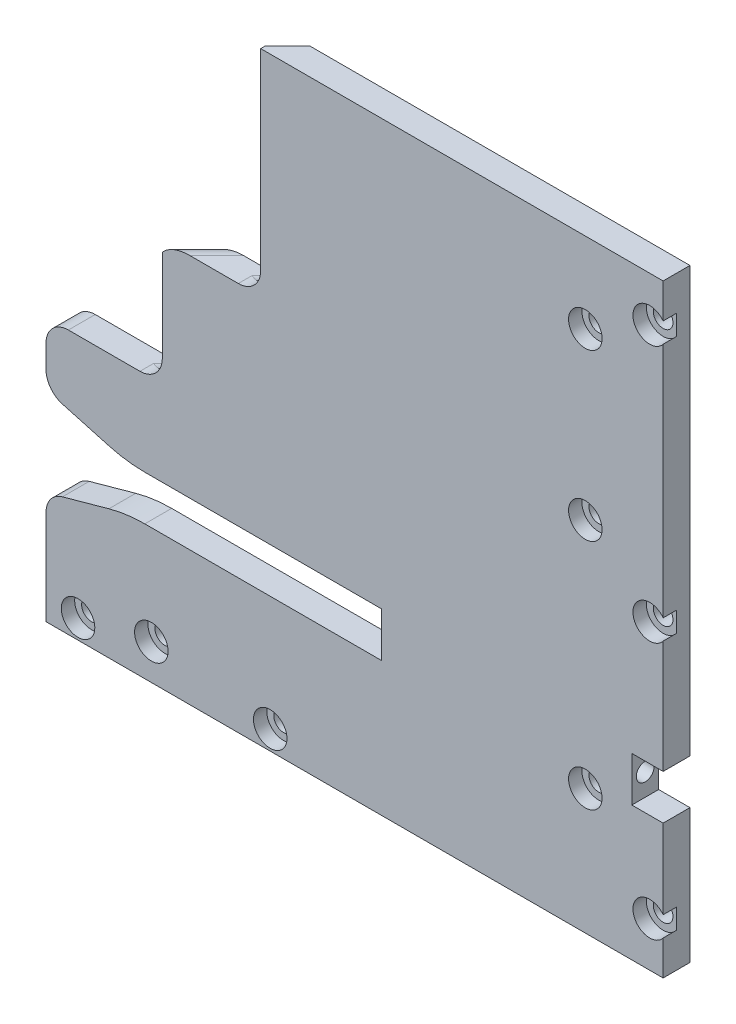
from build123d import *

# Parameters (mm, degrees)
BOSS_EXTRUDE1_DEPTH = 6
CUT_EXTRUDE1_DEPTH  = 194.145023234
SKETCH5_R           = 2
CUT_EXTRUDE2_DEPTH  = 155.550962469
FILLET1_R           = 30
CHAMFER1_SIZE       = 5
FILLET2_R           = 5
SKETCH6_W           = 7
SKETCH6_H           = 10
CUT_EXTRUDE3_DEPTH  = 194.145023234
HOLE1_D             = 4.4
HOLE1_CBORE_D       = 7.5
HOLE1_CBORE_DEPTH   = 3
HOLE2_D             = 4.4
HOLE2_CBORE_D       = 7.5
HOLE2_CBORE_DEPTH   = 3
FILLET3_R           = 5
FILLET5_R           = 5
HOLE3_D             = 4.4
HOLE3_CBORE_D       = 7.5
HOLE3_CBORE_DEPTH   = 3


with BuildPart() as part:
    # Sketch1 → Boss-Extrude1 (new body)
    with BuildSketch(Plane.XY):
        Polygon((0, 0), (-138, 0), (-138, 30), (-63, 30), (-63, 40), (-138, 40), (-138, 59), (-112, 59), (-112, 87), (-90, 87), (-90, 135), (0, 135), align=None)
    extrude(amount=BOSS_EXTRUDE1_DEPTH)

    # Sketch4 → Cut-Extrude1 (cut, through all)
    with BuildSketch(Plane(origin=(0, 0, 0), x_dir=(-1, 0, 0), z_dir=(0, 0, -1))):
        Polygon((120, 40), (138, 45), (138, 40), align=None)
        Polygon((120, 30), (138, 30), (138, 25), align=None)
    extrude(amount=-CUT_EXTRUDE1_DEPTH, mode=Mode.SUBTRACT)

    # Sketch5 → Cut-Extrude2 (cut, through all)
    with BuildSketch(Plane.ZY.offset(63)):
        with Locations((3, 35)):
            Circle(SKETCH5_R)
    extrude(amount=-CUT_EXTRUDE2_DEPTH, mode=Mode.SUBTRACT)

    # Fillet1
    fillet1_edges = [part.edges().sort_by_distance(p)[0] for p in [
        (-120, 40, 3),
        (-120, 30, 3),
    ]]
    fillet(fillet1_edges, radius=FILLET1_R)

    # Chamfer1
    chamfer1_edges = [part.edges().sort_by_distance(p)[0] for p in [
        (-112, 73, 0),
        (-90, 111, 0),
    ]]
    chamfer(chamfer1_edges, length=CHAMFER1_SIZE)

    # Fillet2
    fillet2_edges = [part.edges().sort_by_distance(p)[0] for p in [
        (-138, 25, 3),
        (-138, 45, 3),
        (-138, 59, 3),
    ]]
    fillet(fillet2_edges, radius=FILLET2_R)

    # Sketch6 → Cut-Extrude3 (cut, through all)
    with BuildSketch(Plane.XY.offset(6)):
        with Locations((-3.5, 35)):
            Rectangle(SKETCH6_W, SKETCH6_H)
    extrude(amount=-CUT_EXTRUDE3_DEPTH, mode=Mode.SUBTRACT)

    # Hole1 (through all)
    with Locations(Plane.XY.offset(6)):
        with Locations((-17.4, 117), (-17.4, 80), (-17.4, 28)):
            CounterBoreHole(HOLE1_D / 2, HOLE1_CBORE_D / 2, HOLE1_CBORE_DEPTH)

    # Hole2 (through all)
    with Locations(Plane.XY.offset(6)):
        with Locations((-3, 125), (-3, 67.5), (-3, 10)):
            CounterBoreHole(HOLE2_D / 2, HOLE2_CBORE_D / 2, HOLE2_CBORE_DEPTH)

    # Fillet3
    fillet3_edges = [part.edges().sort_by_distance(p)[0] for p in [
        (-112, 59, 5.5),
        (-109.5, 59, 2.5),
        (-90, 87, 5.5),
        (-87.5, 87, 2.5),
    ]]
    fillet(fillet3_edges, radius=FILLET3_R)

    # Fillet5
    fillet5_edges = [part.edges().sort_by_distance(p)[0] for p in [
        (-109.5, 87, 2.5),
    ]]
    fillet(fillet5_edges, radius=FILLET5_R)

    # Hole3 (through all)
    with Locations(Plane.XY.offset(6)):
        with Locations((-130.844995532, 4.293591352), (-114.451398707, 7.906888356), (-87.870353785, 4.293591352)):
            CounterBoreHole(HOLE3_D / 2, HOLE3_CBORE_D / 2, HOLE3_CBORE_DEPTH)


solid = part.part
